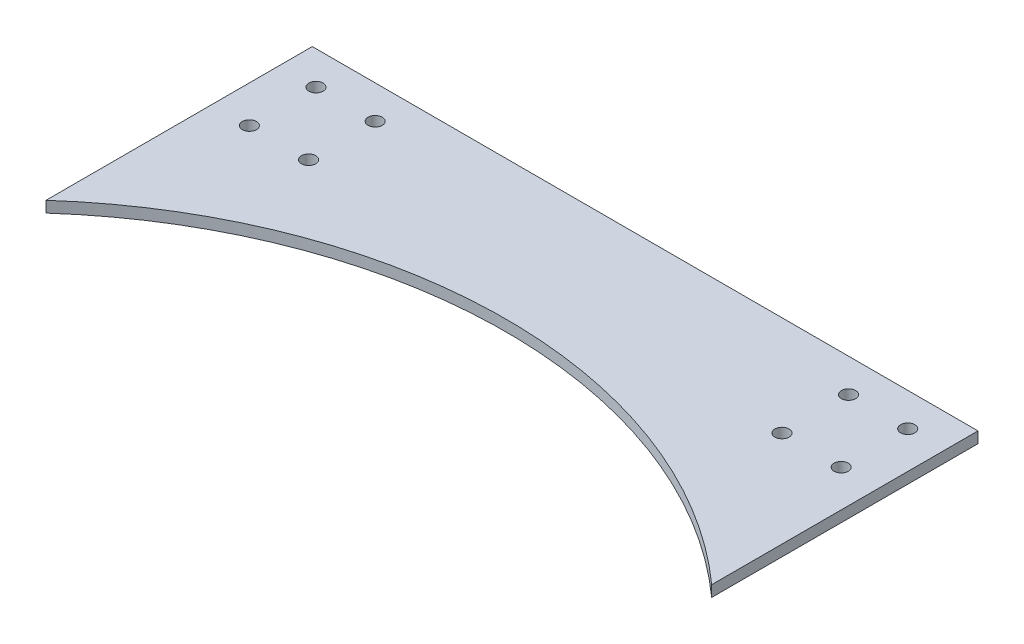
from build123d import *

# Parameters (mm, degrees)
BOSS_EXTRUDE1_DEPTH = 3.175
SKETCH3_R           = 2.032
CUT_EXTRUDE1_DEPTH  = 206.199343627


with BuildPart() as part:
    # Sketch1 → Boss-Extrude1 (new body)
    with BuildSketch(Plane(origin=(0, 0, 0), x_dir=(1, 0, 0), z_dir=(0, 1, 0))):
        with BuildLine():
            Line((0, 0), (0, 76.2))
            Line((0, 76.2), (190.5, 76.2))
            Line((190.5, 76.2), (190.5, 0))
            ThreePointArc((190.5, 0), (95.25, 36.382262572), (0, 0))
        make_face()
    extrude(amount=BOSS_EXTRUDE1_DEPTH)

    # Sketch3 → Cut-Extrude1 (cut, through all)
    with BuildSketch(Plane.XZ):
        with Locations((10.583333333, -66.675)):
            Circle(SKETCH3_R)
        with Locations((10.583333333, -47.625)):
            Circle(SKETCH3_R)
        with Locations((27.516666667, -47.625)):
            Circle(SKETCH3_R)
        with Locations((27.516666667, -66.675)):
            Circle(SKETCH3_R)
        with Locations((162.983333333, -66.675)):
            Circle(SKETCH3_R)
        with Locations((162.983333333, -47.625)):
            Circle(SKETCH3_R)
        with Locations((179.916666667, -47.625)):
            Circle(SKETCH3_R)
        with Locations((179.916666667, -66.675)):
            Circle(SKETCH3_R)
    extrude(amount=-CUT_EXTRUDE1_DEPTH, mode=Mode.SUBTRACT)


solid = part.part
